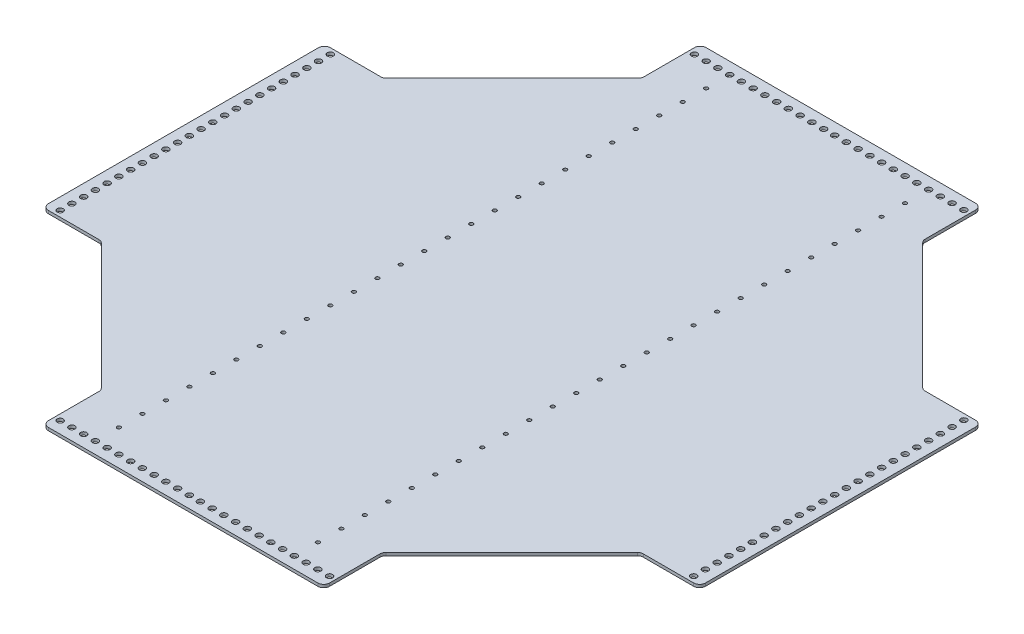
from build123d import *

# Parameters (mm, degrees)
BOSS_EXTRUDE2_DEPTH = 1.5875
SKETCH2_R           = 3.2639
CUT_EXTRUDE1_DEPTH  = 795.974704399
LPATTERN1_START     = -1.5875
LPATTERN1_OUTLINE_R = 3.2639
LPATTERN1_DEPTH     = 3.175
LPATTERN2_START     = -1.5875
LPATTERN2_OUTLINE_R = 3.2639
LPATTERN2_DEPTH     = 3.175
SKETCH3_R           = 2.0193
SKETCH3_R_2         = 3.2639
CUT_EXTRUDE2_DEPTH  = 795.974704399
MIRROR2_START       = -1.5875
MIRROR2_OUTLINE_R   = 3.2639
MIRROR2_DEPTH       = 3.175
FILLET1_R           = 6.35


# Read off the part's stored shape, not the designer's step: LPattern1, LPattern2, Mirror2
with BuildPart() as part:
    # Sketch1 → Boss-Extrude2 (new, symmetric)
    with BuildSketch(Plane(origin=(0, 0, 0), x_dir=(1, 0, 0), z_dir=(0, 1, 0))):
        Polygon((0, 203.2), (63.5, 203.2), (133.096984938, 133.603015062), (203.2, 63.5), (203.2, 0), (355.203125, 0), (355.203125, 711.2), (203.2, 711.2), (203.2, 647.7), (63.5, 508), (0, 508), align=None)
    boss_extrude2 = extrude(amount=BOSS_EXTRUDE2_DEPTH, both=True)

    # Sketch2 → Cut-Extrude1 (cut, through all)
    with BuildSketch(Plane(origin=(0, 1.5875, 0), x_dir=(1, 0, 0), z_dir=(0, 1, 0))):
        with Locations(Location((209.55, 698.5, 0), (0, 0, 270))):
            Circle(SKETCH2_R)
        with Locations(Location((12.7, 501.65, 0), (0, 0, 270))):
            Circle(SKETCH2_R)
        with Locations(Location((209.55, 12.7, 0), (0, 0, 270))):
            Circle(SKETCH2_R)
    cut_extrude1 = extrude(amount=-CUT_EXTRUDE1_DEPTH, mode=Mode.SUBTRACT)

    # LPattern1 outline → LPattern1 (cut)
    with BuildSketch(Plane(origin=(0, 0, 0), x_dir=(1, 0, 0), z_dir=(0, 1, 0)).offset(LPATTERN1_START)):
        with Locations((12.7, 209.55)):
            Circle(LPATTERN1_OUTLINE_R)
        with Locations((12.7, 222.25)):
            Circle(LPATTERN1_OUTLINE_R)
        with Locations((12.7, 234.95)):
            Circle(LPATTERN1_OUTLINE_R)
        with Locations((12.7, 247.65)):
            Circle(LPATTERN1_OUTLINE_R)
        with Locations((12.7, 260.35)):
            Circle(LPATTERN1_OUTLINE_R)
        with Locations((12.7, 273.05)):
            Circle(LPATTERN1_OUTLINE_R)
        with Locations((12.7, 285.75)):
            Circle(LPATTERN1_OUTLINE_R)
        with Locations((12.7, 298.45)):
            Circle(LPATTERN1_OUTLINE_R)
        with Locations((12.7, 311.15)):
            Circle(LPATTERN1_OUTLINE_R)
        with Locations((12.7, 323.85)):
            Circle(LPATTERN1_OUTLINE_R)
        with Locations((12.7, 336.55)):
            Circle(LPATTERN1_OUTLINE_R)
        with Locations((12.7, 349.25)):
            Circle(LPATTERN1_OUTLINE_R)
        with Locations((12.7, 361.95)):
            Circle(LPATTERN1_OUTLINE_R)
        with Locations((12.7, 374.65)):
            Circle(LPATTERN1_OUTLINE_R)
        with Locations((12.7, 387.35)):
            Circle(LPATTERN1_OUTLINE_R)
        with Locations((12.7, 400.05)):
            Circle(LPATTERN1_OUTLINE_R)
        with Locations((12.7, 412.75)):
            Circle(LPATTERN1_OUTLINE_R)
        with Locations((12.7, 425.45)):
            Circle(LPATTERN1_OUTLINE_R)
        with Locations((12.7, 438.15)):
            Circle(LPATTERN1_OUTLINE_R)
        with Locations((12.7, 450.85)):
            Circle(LPATTERN1_OUTLINE_R)
        with Locations((12.7, 463.55)):
            Circle(LPATTERN1_OUTLINE_R)
        with Locations((12.7, 476.25)):
            Circle(LPATTERN1_OUTLINE_R)
        with Locations((12.7, 488.95)):
            Circle(LPATTERN1_OUTLINE_R)
    extrude(amount=LPATTERN1_DEPTH, mode=Mode.SUBTRACT)

    # LPattern2 outline → LPattern2 (cut)
    with BuildSketch(Plane(origin=(0, 0, 0), x_dir=(1, 0, 0), z_dir=(0, 1, 0)).offset(LPATTERN2_START)):
        with Locations((349.25, 12.7)):
            Circle(LPATTERN2_OUTLINE_R)
        with Locations((349.25, 698.5)):
            Circle(LPATTERN2_OUTLINE_R)
        with Locations((336.55, 12.7)):
            Circle(LPATTERN2_OUTLINE_R)
        with Locations((336.55, 698.5)):
            Circle(LPATTERN2_OUTLINE_R)
        with Locations((323.85, 12.7)):
            Circle(LPATTERN2_OUTLINE_R)
        with Locations((323.85, 698.5)):
            Circle(LPATTERN2_OUTLINE_R)
        with Locations((311.15, 12.7)):
            Circle(LPATTERN2_OUTLINE_R)
        with Locations((311.15, 698.5)):
            Circle(LPATTERN2_OUTLINE_R)
        with Locations((298.45, 12.7)):
            Circle(LPATTERN2_OUTLINE_R)
        with Locations((298.45, 698.5)):
            Circle(LPATTERN2_OUTLINE_R)
        with Locations((285.75, 12.7)):
            Circle(LPATTERN2_OUTLINE_R)
        with Locations((285.75, 698.5)):
            Circle(LPATTERN2_OUTLINE_R)
        with Locations((273.05, 12.7)):
            Circle(LPATTERN2_OUTLINE_R)
        with Locations((273.05, 698.5)):
            Circle(LPATTERN2_OUTLINE_R)
        with Locations((260.35, 12.7)):
            Circle(LPATTERN2_OUTLINE_R)
        with Locations((260.35, 698.5)):
            Circle(LPATTERN2_OUTLINE_R)
        with Locations((247.65, 12.7)):
            Circle(LPATTERN2_OUTLINE_R)
        with Locations((247.65, 698.5)):
            Circle(LPATTERN2_OUTLINE_R)
        with Locations((234.95, 12.7)):
            Circle(LPATTERN2_OUTLINE_R)
        with Locations((234.95, 698.5)):
            Circle(LPATTERN2_OUTLINE_R)
        with Locations((222.25, 12.7)):
            Circle(LPATTERN2_OUTLINE_R)
        with Locations((222.25, 698.5)):
            Circle(LPATTERN2_OUTLINE_R)
    lpattern2 = extrude(amount=LPATTERN2_DEPTH, mode=Mode.SUBTRACT)

    # Sketch3 → Cut-Extrude2 (cut, through all)
    # profile 1 of 27: a face of its own
    with BuildSketch(Plane(origin=(0, 1.5875, 0), x_dir=(1, 0, 0), z_dir=(0, 1, 0))):
        with Locations(Location((247.65, 673.1, 0), (0, 0, 270))):
            Circle(SKETCH3_R)
    # profile 2 of 27: a face of its own
    with BuildSketch(Plane(origin=(0, 1.5875, 0), x_dir=(1, 0, 0), z_dir=(0, 1, 0))):
        with Locations(Location((247.65, 647.7, 0), (0, 0, 270))):
            Circle(SKETCH3_R)
    # profile 3 of 27: a face of its own
    with BuildSketch(Plane(origin=(0, 1.5875, 0), x_dir=(1, 0, 0), z_dir=(0, 1, 0))):
        with Locations(Location((247.65, 622.3, 0), (0, 0, 270))):
            Circle(SKETCH3_R)
    # profile 4 of 27: a face of its own
    with BuildSketch(Plane(origin=(0, 1.5875, 0), x_dir=(1, 0, 0), z_dir=(0, 1, 0))):
        with Locations(Location((247.65, 596.9, 0), (0, 0, 270))):
            Circle(SKETCH3_R)
    # profile 5 of 27: a face of its own
    with BuildSketch(Plane(origin=(0, 1.5875, 0), x_dir=(1, 0, 0), z_dir=(0, 1, 0))):
        with Locations(Location((247.65, 571.5, 0), (0, 0, 270))):
            Circle(SKETCH3_R)
    # profile 6 of 27: a face of its own
    with BuildSketch(Plane(origin=(0, 1.5875, 0), x_dir=(1, 0, 0), z_dir=(0, 1, 0))):
        with Locations(Location((247.65, 546.1, 0), (0, 0, 270))):
            Circle(SKETCH3_R)
    # profile 7 of 27: a face of its own
    with BuildSketch(Plane(origin=(0, 1.5875, 0), x_dir=(1, 0, 0), z_dir=(0, 1, 0))):
        with Locations(Location((247.65, 520.7, 0), (0, 0, 270))):
            Circle(SKETCH3_R)
    # profile 8 of 27: a face of its own
    with BuildSketch(Plane(origin=(0, 1.5875, 0), x_dir=(1, 0, 0), z_dir=(0, 1, 0))):
        with Locations(Location((247.65, 495.3, 0), (0, 0, 270))):
            Circle(SKETCH3_R)
    # profile 9 of 27: a face of its own
    with BuildSketch(Plane(origin=(0, 1.5875, 0), x_dir=(1, 0, 0), z_dir=(0, 1, 0))):
        with Locations(Location((247.65, 469.9, 0), (0, 0, 270))):
            Circle(SKETCH3_R)
    # profile 10 of 27: a face of its own
    with BuildSketch(Plane(origin=(0, 1.5875, 0), x_dir=(1, 0, 0), z_dir=(0, 1, 0))):
        with Locations(Location((247.65, 444.5, 0), (0, 0, 270))):
            Circle(SKETCH3_R)
    # profile 11 of 27: a face of its own
    with BuildSketch(Plane(origin=(0, 1.5875, 0), x_dir=(1, 0, 0), z_dir=(0, 1, 0))):
        with Locations(Location((247.65, 419.1, 0), (0, 0, 270))):
            Circle(SKETCH3_R)
    # profile 12 of 27: a face of its own
    with BuildSketch(Plane(origin=(0, 1.5875, 0), x_dir=(1, 0, 0), z_dir=(0, 1, 0))):
        with Locations(Location((247.65, 393.7, 0), (0, 0, 270))):
            Circle(SKETCH3_R)
    # profile 13 of 27: a face of its own
    with BuildSketch(Plane(origin=(0, 1.5875, 0), x_dir=(1, 0, 0), z_dir=(0, 1, 0))):
        with Locations(Location((247.65, 368.3, 0), (0, 0, 270))):
            Circle(SKETCH3_R)
    # profile 14 of 27: a face of its own
    with BuildSketch(Plane(origin=(0, 1.5875, 0), x_dir=(1, 0, 0), z_dir=(0, 1, 0))):
        with Locations(Location((247.65, 342.9, 0), (0, 0, 270))):
            Circle(SKETCH3_R)
    # profile 15 of 27: a face of its own
    with BuildSketch(Plane(origin=(0, 1.5875, 0), x_dir=(1, 0, 0), z_dir=(0, 1, 0))):
        with Locations(Location((247.65, 317.5, 0), (0, 0, 270))):
            Circle(SKETCH3_R)
    # profile 16 of 27: a face of its own
    with BuildSketch(Plane(origin=(0, 1.5875, 0), x_dir=(1, 0, 0), z_dir=(0, 1, 0))):
        with Locations(Location((247.65, 292.1, 0), (0, 0, 270))):
            Circle(SKETCH3_R)
    # profile 17 of 27: a face of its own
    with BuildSketch(Plane(origin=(0, 1.5875, 0), x_dir=(1, 0, 0), z_dir=(0, 1, 0))):
        with Locations(Location((247.65, 266.7, 0), (0, 0, 270))):
            Circle(SKETCH3_R)
    # profile 18 of 27: a face of its own
    with BuildSketch(Plane(origin=(0, 1.5875, 0), x_dir=(1, 0, 0), z_dir=(0, 1, 0))):
        with Locations(Location((247.65, 241.3, 0), (0, 0, 270))):
            Circle(SKETCH3_R)
    # profile 19 of 27: a face of its own
    with BuildSketch(Plane(origin=(0, 1.5875, 0), x_dir=(1, 0, 0), z_dir=(0, 1, 0))):
        with Locations(Location((247.65, 215.9, 0), (0, 0, 270))):
            Circle(SKETCH3_R)
    # profile 20 of 27: a face of its own
    with BuildSketch(Plane(origin=(0, 1.5875, 0), x_dir=(1, 0, 0), z_dir=(0, 1, 0))):
        with Locations(Location((247.65, 190.5, 0), (0, 0, 270))):
            Circle(SKETCH3_R)
    # profile 21 of 27: a face of its own
    with BuildSketch(Plane(origin=(0, 1.5875, 0), x_dir=(1, 0, 0), z_dir=(0, 1, 0))):
        with Locations(Location((247.65, 165.1, 0), (0, 0, 270))):
            Circle(SKETCH3_R)
    # profile 22 of 27: a face of its own
    with BuildSketch(Plane(origin=(0, 1.5875, 0), x_dir=(1, 0, 0), z_dir=(0, 1, 0))):
        with Locations(Location((247.65, 139.7, 0), (0, 0, 270))):
            Circle(SKETCH3_R)
    # profile 23 of 27: a face of its own
    with BuildSketch(Plane(origin=(0, 1.5875, 0), x_dir=(1, 0, 0), z_dir=(0, 1, 0))):
        with Locations(Location((247.65, 114.3, 0), (0, 0, 270))):
            Circle(SKETCH3_R)
    # profile 24 of 27: a face of its own
    with BuildSketch(Plane(origin=(0, 1.5875, 0), x_dir=(1, 0, 0), z_dir=(0, 1, 0))):
        with Locations(Location((247.65, 88.9, 0), (0, 0, 270))):
            Circle(SKETCH3_R)
    # profile 25 of 27: a face of its own
    with BuildSketch(Plane(origin=(0, 1.5875, 0), x_dir=(1, 0, 0), z_dir=(0, 1, 0))):
        with Locations(Location((247.65, 63.5, 0), (0, 0, 270))):
            Circle(SKETCH3_R)
    # profile 26 of 27: a face of its own
    with BuildSketch(Plane(origin=(0, 1.5875, 0), x_dir=(1, 0, 0), z_dir=(0, 1, 0))):
        with Locations(Location((247.65, 38.1, 0), (0, 0, 270))):
            Circle(SKETCH3_R)
    # profile 27 of 27: a face of its own
    with BuildSketch(Plane(origin=(0, 1.5875, 0), x_dir=(1, 0, 0), z_dir=(0, 1, 0))):
        with Locations(Location((247.65, 698.5, 0), (0, 0, 270))):
            Circle(SKETCH3_R_2)
        with Locations((247.65, 698.5)):
            Circle(SKETCH3_R, mode=Mode.SUBTRACT)
    cut_extrude2 = extrude(amount=-CUT_EXTRUDE2_DEPTH, mode=Mode.SUBTRACT)

    # Mirror1: Boss-Extrude2 across plane
    add(boss_extrude2.mirror(Plane(origin=(355.203125, 0, 0), x_dir=(0, 0, 1), z_dir=(1, 0, 0))))

    # Mirror2 outline → Mirror2 (cut)
    with BuildSketch(Plane(origin=(0, 0, 0), x_dir=(1, 0, 0), z_dir=(0, 1, 0)).offset(MIRROR2_START)):
        with Locations((697.70625, 209.55)):
            Circle(MIRROR2_OUTLINE_R)
        with Locations((697.70625, 222.25)):
            Circle(MIRROR2_OUTLINE_R)
        with Locations((697.70625, 234.95)):
            Circle(MIRROR2_OUTLINE_R)
        with Locations((697.70625, 247.65)):
            Circle(MIRROR2_OUTLINE_R)
        with Locations((697.70625, 260.35)):
            Circle(MIRROR2_OUTLINE_R)
        with Locations((697.70625, 273.05)):
            Circle(MIRROR2_OUTLINE_R)
        with Locations((697.70625, 285.75)):
            Circle(MIRROR2_OUTLINE_R)
        with Locations((697.70625, 298.45)):
            Circle(MIRROR2_OUTLINE_R)
        with Locations((697.70625, 311.15)):
            Circle(MIRROR2_OUTLINE_R)
        with Locations((697.70625, 323.85)):
            Circle(MIRROR2_OUTLINE_R)
        with Locations((697.70625, 336.55)):
            Circle(MIRROR2_OUTLINE_R)
        with Locations((697.70625, 349.25)):
            Circle(MIRROR2_OUTLINE_R)
        with Locations((697.70625, 361.95)):
            Circle(MIRROR2_OUTLINE_R)
        with Locations((697.70625, 374.65)):
            Circle(MIRROR2_OUTLINE_R)
        with Locations((697.70625, 387.35)):
            Circle(MIRROR2_OUTLINE_R)
        with Locations((697.70625, 400.05)):
            Circle(MIRROR2_OUTLINE_R)
        with Locations((697.70625, 412.75)):
            Circle(MIRROR2_OUTLINE_R)
        with Locations((697.70625, 425.45)):
            Circle(MIRROR2_OUTLINE_R)
        with Locations((697.70625, 438.15)):
            Circle(MIRROR2_OUTLINE_R)
        with Locations((697.70625, 450.85)):
            Circle(MIRROR2_OUTLINE_R)
        with Locations((697.70625, 463.55)):
            Circle(MIRROR2_OUTLINE_R)
        with Locations((697.70625, 476.25)):
            Circle(MIRROR2_OUTLINE_R)
        with Locations((697.70625, 488.95)):
            Circle(MIRROR2_OUTLINE_R)
        with Locations((697.70625, 501.65)):
            Circle(MIRROR2_OUTLINE_R)
    extrude(amount=MIRROR2_DEPTH, mode=Mode.SUBTRACT)

    # Mirror3: Cut-Extrude1, LPattern2 across plane
    add(cut_extrude1.mirror(Plane(origin=(355.203125, 0, 0), x_dir=(0, 0, 1), z_dir=(1, 0, 0))), mode=Mode.SUBTRACT)
    add(lpattern2.mirror(Plane(origin=(355.203125, 0, 0), x_dir=(0, 0, 1), z_dir=(1, 0, 0))), mode=Mode.SUBTRACT)

    # Mirror4: Cut-Extrude2 across plane
    add(cut_extrude2.mirror(Plane(origin=(355.203125, 0, 0), x_dir=(0, 0, 1), z_dir=(1, 0, 0))), mode=Mode.SUBTRACT)

    # Fillet1
    fillet1_edges = [part.edges().sort_by_distance(p)[0] for p in [
        (0, 0, -508),
        (63.5, 0, -508),
        (203.2, 0, -647.7),
        (203.2, 0, -711.2),
        (203.2, 0, 0),
        (203.2, 0, -63.5),
        (63.5, 0, -203.2),
        (0, 0, -203.2),
        (710.40625, 0, -203.2),
        (710.40625, 0, -508),
        (646.90625, 0, -508),
        (507.20625, 0, -647.7),
        (507.20625, 0, -711.2),
        (507.20625, 0, 0),
        (507.20625, 0, -63.5),
        (646.90625, 0, -203.2),
    ]]
    fillet(fillet1_edges, radius=FILLET1_R)


solid = part.part
